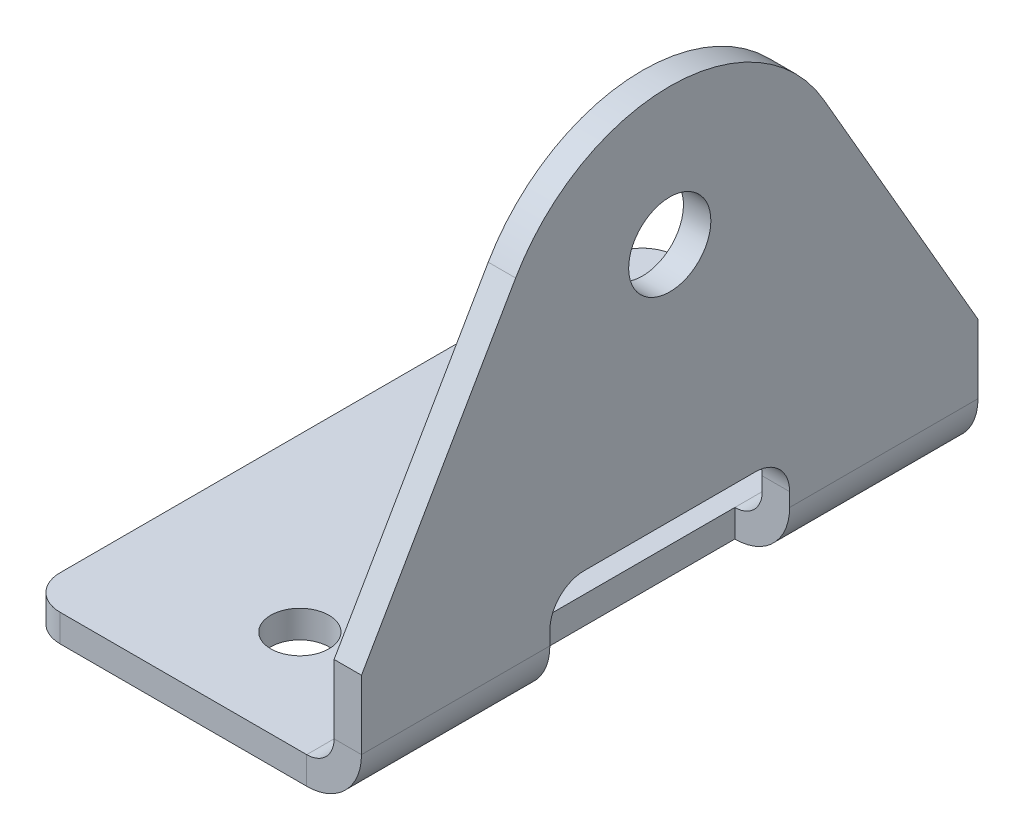
from build123d import *

# Parameters (mm, degrees)
SKETCH_1_W             = 41
SKETCH_1_H             = 90
SM_BASE_FLANGE_1_DEPTH = 4
SM_EDGE_FLANGE_1_DEPTH = 90
SKETCH_9_R             = 4.25
CUT_EXTRUDE_1_DEPTH    = 10
SKETCH_11_R            = 6
CUT_EXTRUDE_2_DEPTH    = 10
SKETCH_12_W            = 35
SKETCH_12_H            = 15
CUT_EXTRUDE_3_DEPTH    = 8
CHAMFER_1_SIZE         = 30
CHAMFER_1_SIZE2        = 51.961524227
FILLET_1_R             = 25.980762
FILLET_2_R             = 5


# Sheet-metal steps are written as plain solids
with BuildPart() as part:
    # Sketch 1 → Базовая кромка1 (new body)
    with BuildSketch(Plane(origin=(0, 0, 0), x_dir=(1, 0, 0), z_dir=(0, 1, 0))):
        Rectangle(SKETCH_1_W, SKETCH_1_H)
    extrude(amount=SM_BASE_FLANGE_1_DEPTH)

    # Ребро-кромка1 section (across the edge) → Ребро-кромка1 (add)
    with BuildSketch(Plane(origin=(24.5, 4, 45), x_dir=(-1, 0, 0), z_dir=(0, 0, -1))):
        with BuildLine():
            Line((-4, 4), (-4, 66))
            Line((-4, 66), (0, 66))
            Line((0, 66), (0, 4))
            ThreePointArc((0, 4), (1.171572875, 1.171572875), (4, 0))
            Line((4, 0), (4, -4))
            ThreePointArc((4, -4), (-1.656854249, -1.656854249), (-4, 4))
        make_face()
    extrude(amount=SM_EDGE_FLANGE_1_DEPTH)

    # Эскиз9 → Вырез-Вытянуть1 (cut)
    with BuildSketch(Plane.XZ):
        with Locations(Location((4.5, 30, 0), (0, 0, 270))):
            Circle(SKETCH_9_R)
        with Locations(Location((4.5, -30, 0), (0, 0, 270))):
            Circle(SKETCH_9_R)
    extrude(amount=-CUT_EXTRUDE_1_DEPTH, mode=Mode.SUBTRACT)

    # Эскиз11 → Вырез-Вытянуть2 (cut)
    with BuildSketch(Plane(origin=(28.5, 0, 0), x_dir=(0, 0, -1), z_dir=(1, 0, 0))):
        with Locations(Location((0, 50, 0), (0, 0, 90))):
            Circle(SKETCH_11_R)
    extrude(amount=-CUT_EXTRUDE_2_DEPTH, mode=Mode.SUBTRACT)

    # Эскиз12 → Вырез-Вытянуть3 (cut)
    with BuildSketch(Plane(origin=(28.5, 0, 0), x_dir=(0, 0, -1), z_dir=(1, 0, 0))):
        with Locations((0, 7.5)):
            Rectangle(SKETCH_12_W, SKETCH_12_H)
    extrude(amount=-CUT_EXTRUDE_3_DEPTH, mode=Mode.SUBTRACT)

    # Фаска1
    chamfer_1_edges = [part.edges().sort_by_distance(p)[0] for p in [
        (26.5, 70, 45),
        (26.5, 70, -45),
    ]]
    chamfer_1_side = [part.faces().sort_by_distance(p)[0] for p in [
        (26.5, 70, 0),
    ]]
    chamfer(chamfer_1_edges, length=CHAMFER_1_SIZE, length2=CHAMFER_1_SIZE2, reference=chamfer_1_side[0])

    # Скругление1
    fillet_1_edges = [part.edges().sort_by_distance(p)[0] for p in [
        (26.5, 70, -15),
        (26.5, 70, 15),
    ]]
    fillet(fillet_1_edges, radius=FILLET_1_R)

    # Скругление2
    fillet_2_edges = [part.edges().sort_by_distance(p)[0] for p in [
        (26.5, 15, 17.5),
        (26.5, 15, -17.5),
        (-20.5, 2, -45),
        (-20.5, 2, 45),
    ]]
    fillet(fillet_2_edges, radius=FILLET_2_R)


solid = part.part
